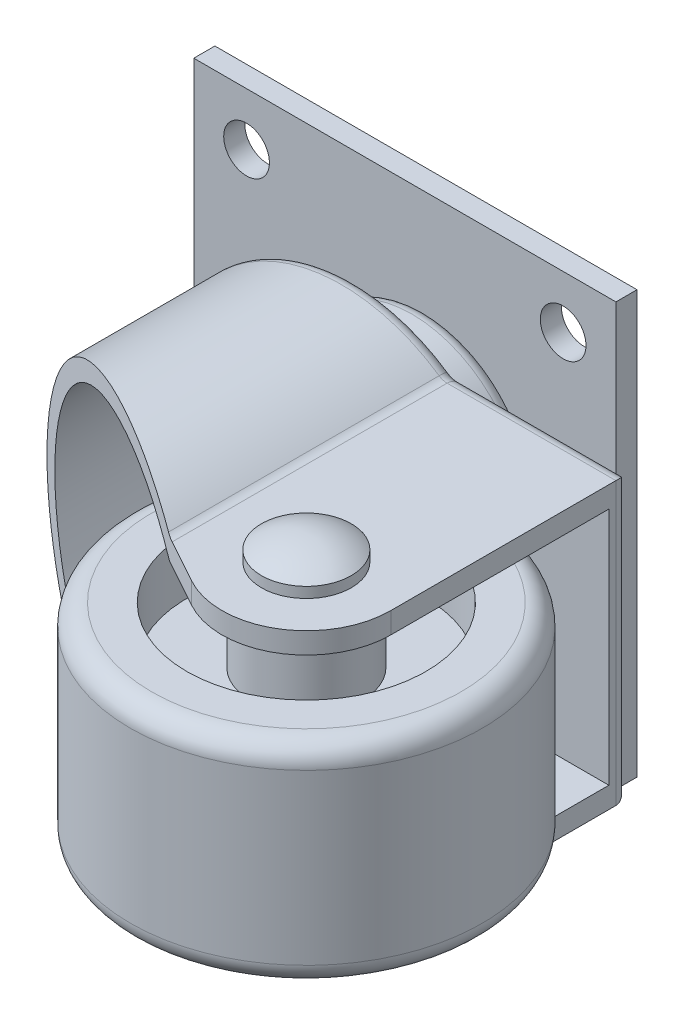
from build123d import *

# Parameters (mm, degrees)
EXTRUDE_1_DEPTH          = 3
EXTRUDE_2_DEPTH          = 53
CUT_EXTRUDE_1_DEPTH      = 13
CUT_EXTRUDE_1_DEPTH_BACK = 3
CUT_EXTRUDE_2_DEPTH      = 13
CUT_EXTRUDE_2_DEPTH_BACK = 3
CUT_EXTRUDE_3_DEPTH      = 43
CUT_EXTRUDE_4_DEPTH      = 53
EXTRUDE_3_DEPTH          = 3
SKETCH_9_R               = 16.008743555
EXTRUDE_4_DEPTH          = 10
FILLET_1_R               = 2
SKETCH_11_W              = 60
SKETCH_11_H              = 60
SKETCH_11_R              = 3.25
EXTRUDE_6_DEPTH          = 3
SKETCH_12_R              = 6.388783443
EXTRUDE_7_DEPTH          = 1.5


# Read off the part's stored shape, not the designer's step: 圆顶1
with BuildPart() as part:
    # 草图1 → 旋转1 (revolve)
    with BuildSketch(Plane.XY, mode=Mode.PRIVATE) as revolve_1_sk:
        with BuildLine():
            Line((-15.974131822, -4.005285962), (-6.974131822, -4.005285962))
            Line((-6.974131822, -4.005285962), (-6.974131822, 3.994714038))
            Line((-6.974131822, 3.994714038), (-0.974131822, 3.994714038))
            Line((-0.974131822, 3.994714038), (-0.974131822, 5.994714038))
            Line((-0.974131822, 5.994714038), (1.025868178, 5.994714038))
            Line((1.025868178, 5.994714038), (1.025868178, 3.994714038))
            Line((1.025868178, 3.994714038), (1.025868178, -26.005285962))
            Line((1.025868178, -26.005285962), (1.025868178, -28.005285962))
            Line((1.025868178, -28.005285962), (-0.974131822, -28.005285962))
            Line((-0.974131822, -28.005285962), (-0.974131822, -26.005285962))
            Line((-0.974131822, -26.005285962), (-6.974131822, -26.005285962))
            Line((-6.974131822, -26.005285962), (-6.974131822, -18.005285962))
            Line((-6.974131822, -18.005285962), (-15.974131822, -18.005285962))
            Line((-15.974131822, -18.005285962), (-15.974131822, -26.005285962))
            Line((-15.974131822, -26.005285962), (-20.974131822, -26.005285962))
            ThreePointArc((-20.974131822, -26.005285962), (-23.095452166, -25.126606305), (-23.974131822, -23.005285962))
            Line((-23.974131822, -23.005285962), (-23.974131822, 0.994714038))
            ThreePointArc((-23.974131822, 0.994714038), (-23.095452166, 3.116034382), (-20.974131822, 3.994714038))
            Line((-20.974131822, 3.994714038), (-15.974131822, 3.994714038))
            Line((-15.974131822, 3.994714038), (-15.974131822, -4.005285962))
        make_face()
    revolve(revolve_1_sk.sketch.rotate(Axis((1.025868178, 3.994714038, 0), (0, -1, 0)), 270), axis=Axis((1.025868178, 3.994714038, 0), (0, -1, 0)))

    # 草图2 → 凸台-拉伸1 (add)
    with BuildSketch(Plane(origin=(0, 5.994714038, 0), x_dir=(1, 0, 0), z_dir=(0, 1, 0))):
        with BuildLine():
            Line((-41.969007605, 34), (-41.969007605, 10))
            Line((-41.969007605, 10), (-4.767578546, -10.508852224))
            ThreePointArc((-4.767578546, -10.508852224), (7.128270955, -10.332506005), (13.025868178, 0))
            Line((13.025868178, 0), (13.025868178, 34))
            Line((13.025868178, 34), (-41.969007605, 34))
        make_face()
    extrude_1 = extrude(amount=EXTRUDE_1_DEPTH)

    # 镜向1: 凸台-拉伸1 across plane
    add(extrude_1.mirror(Plane(origin=(0, -11.005285962, 0), x_dir=(0, 0, 1), z_dir=(0, -1, 0))))

    # 草图3 → 凸台-拉伸2 (add)
    with BuildSketch(Plane(origin=(0, 0, -34), x_dir=(-1, 0, 0), z_dir=(0, 0, -1))):
        with BuildLine():
            Line((11.478918221, 8.994714038), (16.486048812, 8.994714038))
            ThreePointArc((16.486048812, 8.994714038), (48.110611199, -11.005285962), (16.486048812, -31.005285962))
            Line((16.486048812, -31.005285962), (11.478918221, -31.005285962))
            ThreePointArc((11.478918221, -31.005285962), (50.67456132, -11.005285962), (11.478918221, 8.994714038))
        make_face()
    extrude(amount=-EXTRUDE_2_DEPTH)

    # 草图4 → 切除-拉伸1 (cut, two sides: drawn at the far end of the back side and taken through both)
    with BuildSketch(Plane(origin=(0, 8.994714038, 0), x_dir=(1, 0, 0), z_dir=(0, 1, 0)).offset(-CUT_EXTRUDE_1_DEPTH_BACK)):
        Polygon((-11.478918221, -19), (-11.478918221, -6.808943992), (-50.67456132, 14.799302585), (-50.67456132, -19), align=None)
    extrude(amount=CUT_EXTRUDE_1_DEPTH + CUT_EXTRUDE_1_DEPTH_BACK, mode=Mode.SUBTRACT)

    # 草图5 → 切除-拉伸2 (cut, two sides: drawn at the far end of the back side and taken through both)
    with BuildSketch(Plane.XZ.offset(31.005285962).offset(-CUT_EXTRUDE_2_DEPTH_BACK)):
        Polygon((-50.67456132, -14.799302585), (-11.478918221, 6.808943992), (-11.478918221, 19), (-50.67456132, 19), align=None)
    extrude(amount=CUT_EXTRUDE_2_DEPTH + CUT_EXTRUDE_2_DEPTH_BACK, mode=Mode.SUBTRACT)

    # 草图6 → 切除-拉伸3 (cut)
    with BuildSketch(Plane.XZ.offset(31.005285962)):
        Polygon((-25.974131822, -1.182152082), (-62.642319146, -21.397032375), (-62.642319146, 19.111249926), (-25.974131822, 19.111249926), align=None)
    extrude(amount=-CUT_EXTRUDE_3_DEPTH, mode=Mode.SUBTRACT)

    # 草图7 → 切除-拉伸4 (cut)
    with BuildSketch(Plane(origin=(0, 0, -34), x_dir=(-1, 0, 0), z_dir=(0, 0, -1))):
        with BuildLine():
            Line((11.795848456, 5.994714038), (25.974131822, 5.994714038))
            Line((25.974131822, 5.994714038), (25.974131822, 8.994714038))
            Line((25.974131822, 8.994714038), (16.486048812, 8.994714038))
            ThreePointArc((16.486048812, 8.994714038), (14.046255885, 7.642756693), (11.795848456, 5.994714038))
        make_face()
        with BuildLine():
            Line((25.974131822, 8.994714038), (25.974131822, 5.994714038))
            Line((25.974131822, 5.994714038), (40.152415189, 5.994714038))
            ThreePointArc((40.152415189, 5.994714038), (37.902007759, 7.642756693), (35.462214833, 8.994714038))
            Line((35.462214833, 8.994714038), (25.974131822, 8.994714038))
        make_face()
        with BuildLine():
            Line((25.974131822, 11.131193415), (25.974131822, 8.994714038))
            Line((25.974131822, 8.994714038), (35.462214833, 8.994714038))
            ThreePointArc((35.462214833, 8.994714038), (30.836956705, 10.590469486), (25.974131822, 11.131193415))
        make_face()
        with BuildLine():
            Line((16.486048812, 8.994714038), (25.974131822, 8.994714038))
            Line((25.974131822, 8.994714038), (25.974131822, 11.131193415))
            ThreePointArc((25.974131822, 11.131193415), (21.11130694, 10.590469486), (16.486048812, 8.994714038))
        make_face()
        with BuildLine():
            Line((25.974131822, 19.253333442), (25.974131822, 13.695143536))
            ThreePointArc((25.974131822, 13.695143536), (33.593273093, 12.490669087), (40.469345424, 8.994714038))
            Line((40.469345424, 8.994714038), (41.969007605, 8.994714038))
            Line((41.969007605, 8.994714038), (41.969007605, 7.816912795))
            ThreePointArc((41.969007605, 7.816912795), (50.67456132, -11.005285962), (41.969007605, -29.827484719))
            Line((41.969007605, -29.827484719), (41.969007605, -31.005285962))
            Line((41.969007605, -31.005285962), (40.469345424, -31.005285962))
            ThreePointArc((40.469345424, -31.005285962), (33.593273093, -34.501241011), (25.974131822, -35.705715459))
            Line((25.974131822, -35.705715459), (25.974131822, -41.263905366))
            ThreePointArc((25.974131822, -41.263905366), (47.370206792, -32.401360932), (56.232751226, -11.005285962))
            ThreePointArc((56.232751226, -11.005285962), (47.370206792, 10.390789008), (25.974131822, 19.253333442))
        make_face()
        with BuildLine():
            Line((35.462214833, -31.005285962), (25.974131822, -31.005285962))
            Line((25.974131822, -31.005285962), (25.974131822, -33.141765339))
            ThreePointArc((25.974131822, -33.141765339), (30.836956705, -32.60104141), (35.462214833, -31.005285962))
        make_face()
        with BuildLine():
            Line((25.974131822, -31.005285962), (25.974131822, -28.005285962))
            Line((25.974131822, -28.005285962), (11.795848456, -28.005285962))
            ThreePointArc((11.795848456, -28.005285962), (14.046255885, -29.653328616), (16.486048812, -31.005285962))
            Line((16.486048812, -31.005285962), (25.974131822, -31.005285962))
        make_face()
        with BuildLine():
            Line((25.974131822, -33.141765339), (25.974131822, -31.005285962))
            Line((25.974131822, -31.005285962), (16.486048812, -31.005285962))
            ThreePointArc((16.486048812, -31.005285962), (21.11130694, -32.60104141), (25.974131822, -33.141765339))
        make_face()
        with BuildLine():
            Line((40.152415189, -28.005285962), (25.974131822, -28.005285962))
            Line((25.974131822, -28.005285962), (25.974131822, -31.005285962))
            Line((25.974131822, -31.005285962), (35.462214833, -31.005285962))
            ThreePointArc((35.462214833, -31.005285962), (37.902007759, -29.653328616), (40.152415189, -28.005285962))
        make_face()
        with BuildLine():
            Line((25.974131822, 13.695143536), (25.974131822, 13.625056772))
            ThreePointArc((25.974131822, 13.625056772), (43.390414192, 6.410996408), (50.604474556, -11.005285962))
            ThreePointArc((50.604474556, -11.005285962), (43.390414192, -28.421568332), (25.974131822, -35.635628696))
            Line((25.974131822, -35.635628696), (25.974131822, -35.705715459))
            ThreePointArc((25.974131822, -35.705715459), (33.593273093, -34.501241011), (40.469345424, -31.005285962))
            Line((40.469345424, -31.005285962), (41.969007605, -31.005285962))
            Line((41.969007605, -31.005285962), (41.969007605, -29.827484719))
            ThreePointArc((41.969007605, -29.827484719), (50.67456132, -11.005285962), (41.969007605, 7.816912795))
            Line((41.969007605, 7.816912795), (41.969007605, 8.994714038))
            Line((41.969007605, 8.994714038), (40.469345424, 8.994714038))
            ThreePointArc((40.469345424, 8.994714038), (33.593273093, 12.490669087), (25.974131822, 13.695143536))
        make_face()
        with BuildLine():
            ThreePointArc((25.974131822, -35.705715459), (18.354990551, -34.501241011), (11.478918221, -31.005285962))
            Line((11.478918221, -31.005285962), (3.267655913, -31.005285962))
            ThreePointArc((3.267655913, -31.005285962), (13.515968632, -38.58024232), (25.974131822, -41.263905366))
            Line((25.974131822, -41.263905366), (25.974131822, -35.705715459))
        make_face()
        with BuildLine():
            Line((3.267655913, 8.994714038), (11.478918221, 8.994714038))
            ThreePointArc((11.478918221, 8.994714038), (18.354990551, 12.490669087), (25.974131822, 13.695143536))
            Line((25.974131822, 13.695143536), (25.974131822, 19.253333442))
            ThreePointArc((25.974131822, 19.253333442), (13.515968632, 16.569670396), (3.267655913, 8.994714038))
        make_face()
        with BuildLine():
            Line((11.478918221, 8.994714038), (11.598674153, 8.994714038))
            ThreePointArc((11.598674153, 8.994714038), (18.422743588, 12.438909886), (25.974131822, 13.625056772))
            Line((25.974131822, 13.625056772), (25.974131822, 13.695143536))
            ThreePointArc((25.974131822, 13.695143536), (18.354990551, 12.490669087), (11.478918221, 8.994714038))
        make_face()
        with BuildLine():
            ThreePointArc((25.974131822, -35.635628696), (18.422743588, -34.449481809), (11.598674153, -31.005285962))
            Line((11.598674153, -31.005285962), (11.478918221, -31.005285962))
            ThreePointArc((11.478918221, -31.005285962), (18.354990551, -34.501241011), (25.974131822, -35.705715459))
            Line((25.974131822, -35.705715459), (25.974131822, -35.635628696))
        make_face()
    extrude(amount=-CUT_EXTRUDE_4_DEPTH, mode=Mode.SUBTRACT)

    # 草图8 → 凸台-拉伸3 (add)
    with BuildSketch(Plane(origin=(0, 0, -34), x_dir=(-1, 0, 0), z_dir=(0, 0, -1))):
        with BuildLine():
            Line((-13.025868178, 5.994714038), (11.795848456, 5.994714038))
            ThreePointArc((11.795848456, 5.994714038), (48.110611199, -11.005285962), (11.795848456, -28.005285962))
            Line((11.795848456, -28.005285962), (-13.025868178, -28.005285962))
            Line((-13.025868178, -28.005285962), (-13.025868178, 5.994714038))
        make_face()
    extrude(amount=-EXTRUDE_3_DEPTH)

    # 草图9 → 凸台-拉伸4 (add)
    with BuildSketch(Plane(origin=(0, 0, -34), x_dir=(-1, 0, 0), z_dir=(0, 0, -1))):
        with Locations(Location((25.974131822, -11.005285962, 0), (0, 0, 180))):
            Circle(SKETCH_9_R)
    extrude(amount=EXTRUDE_4_DEPTH)

    # 圆角1
    fillet_1_edges = [part.edges().sort_by_distance(p)[0] for p in [
        (-11.598674153, -31.005285962, -13.628538251),
        (-50.604474556, -11.005285962, -34),
        (-11.598674153, 8.994714038, -13.628538251),
        (-41.982875377, -11.005285962, -34),
        (-41.982875377, -11.005285962, -44),
        (13.025868178, -11.005285962, -34),
        (0.713597012, 8.994714038, -34),
        (0.713597012, -31.005285962, -34),
    ]]
    fillet(fillet_1_edges, radius=FILLET_1_R)

    # 草图11 → 凸台-拉伸6 (add)
    with BuildSketch(Plane(origin=(0, 0, -44), x_dir=(-1, 0, 0), z_dir=(0, 0, -1))):
        with Locations((28.974131822, -11.005285962)):
            Rectangle(SKETCH_11_W, SKETCH_11_H)
        with Locations((51.474131822, 11.494714038)):
            Circle(SKETCH_11_R, mode=Mode.SUBTRACT)
        with Locations((51.474131822, -33.505285962)):
            Circle(SKETCH_11_R, mode=Mode.SUBTRACT)
        with Locations((6.474131822, -33.505285962)):
            Circle(SKETCH_11_R, mode=Mode.SUBTRACT)
        with Locations((6.474131822, 11.494714038)):
            Circle(SKETCH_11_R, mode=Mode.SUBTRACT)
    extrude(amount=EXTRUDE_6_DEPTH)

    # 草图12 → 凸台-拉伸7 (add)
    with BuildSketch(Plane(origin=(0, 8.994714038, 0), x_dir=(1, 0, 0), z_dir=(0, 1, 0))):
        with Locations(Location((1.025868178, 0, 0), (0, 0, 270))):
            Circle(SKETCH_12_R)
    extrude_7 = extrude(amount=EXTRUDE_7_DEPTH)

    # 圆顶1 outline → 圆顶1 (revolve)
    with BuildSketch(Plane(origin=(1.025868178, 0, 0), x_dir=(1, 0, 0), z_dir=(0, 0, 1))):
        with BuildLine():
            Line((0, 10.494714038), (6.388783452, 10.494714032))
            ThreePointArc((6.388783452, 10.494714032), (3.347258356, 11.983029933), (0, 12.494714038))
            Line((0, 12.494714038), (0, 10.494714038))
        make_face()
    dome_1 = revolve(axis=Axis((1.025868178, 0, 0), (0, 1, 0)))

    # 镜向2: 凸台-拉伸7, 圆顶1 across plane
    add(extrude_7.mirror(Plane(origin=(0, -11.005285962, 0), x_dir=(0, 0, 1), z_dir=(0, -1, 0))))
    add(dome_1.mirror(Plane(origin=(0, -11.005285962, 0), x_dir=(0, 0, 1), z_dir=(0, -1, 0))))


solid = part.part
